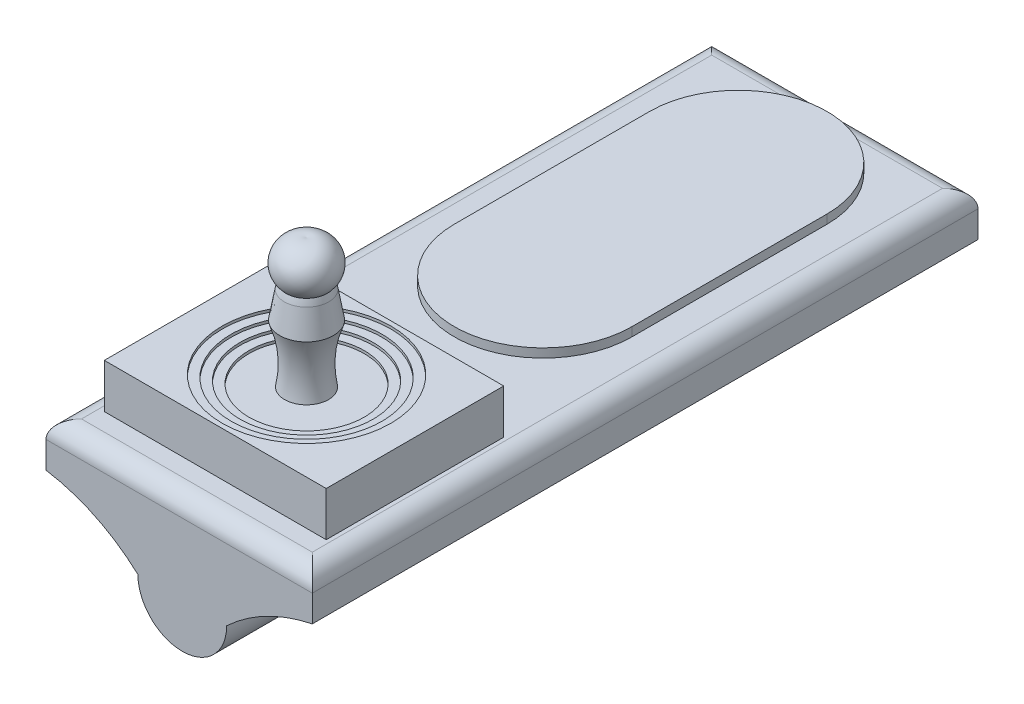
from build123d import *

# Parameters (mm, degrees)
BOSS_EXTRUDE2_DEPTH = 75
SKETCH2_R           = 4
CUT_EXTRUDE1_DEPTH  = 60
BOSS_EXTRUDE3_DEPTH = 1
SKETCH4_W           = 25
SKETCH4_H           = 20
BOSS_EXTRUDE4_DEPTH = 5
SKETCH5_R           = 9.5
CUT_EXTRUDE5_DEPTH  = 0.3
SKETCH9_R           = 8.5
CUT_EXTRUDE6_DEPTH  = 0.3
SKETCH10_R          = 7.5
CUT_EXTRUDE7_DEPTH  = 0.3
SKETCH11_R          = 6.5
CUT_EXTRUDE8_DEPTH  = 0.3
FILLET1_R           = 2


with BuildPart() as part:
    # Sketch1 → Boss-Extrude2 (new body)
    with BuildSketch(Plane.XY):
        with BuildLine():
            Line((-15.355814747, 10), (14.644185253, 10))
            Line((14.644185253, 10), (14.644185253, 5))
            ThreePointArc((14.644185253, 5), (9.476114191, 3.167336025), (5, 0))
            ThreePointArc((5, 0), (0, -5), (-5, 0))
            ThreePointArc((-5, 0), (-9.810792775, 3.260354155), (-15.355814747, 5))
            Line((-15.355814747, 5), (-15.355814747, 10))
        make_face()
    extrude(amount=-BOSS_EXTRUDE2_DEPTH)

    # Sketch2 → Cut-Extrude1 (cut)
    with BuildSketch(Plane(origin=(0, 0, -75), x_dir=(-1, 0, 0), z_dir=(0, 0, -1))):
        Circle(SKETCH2_R)
    extrude(amount=-CUT_EXTRUDE1_DEPTH, mode=Mode.SUBTRACT)

    # Sketch3 → Boss-Extrude3 (add)
    with BuildSketch(Plane(origin=(0, 10, 0), x_dir=(1, 0, 0), z_dir=(0, 1, 0))):
        with BuildLine():
            Line((-10.355814747, 41), (-10.355814747, 63))
            ThreePointArc((-10.355814747, 63), (-0.355814747, 73), (9.644185253, 63))
            Line((9.644185253, 63), (9.644185253, 41))
            ThreePointArc((9.644185253, 41), (-0.355814747, 31), (-10.355814747, 41))
        make_face()
    extrude(amount=BOSS_EXTRUDE3_DEPTH)

    # Sketch4 → Boss-Extrude4 (add)
    with BuildSketch(Plane(origin=(0, 10, 0), x_dir=(1, 0, 0), z_dir=(0, 1, 0))):
        with Locations((-0.28655183, 14)):
            Rectangle(SKETCH4_W, SKETCH4_H)
    extrude(amount=BOSS_EXTRUDE4_DEPTH)

    # Sketch5 → Cut-Extrude5 (cut)
    with BuildSketch(Plane(origin=(0, 15, 0), x_dir=(1, 0, 0), z_dir=(0, 1, 0))):
        with Locations(Location((0, 14, 0), (0, 0, 270))):
            Circle(SKETCH5_R)
    extrude(amount=-CUT_EXTRUDE5_DEPTH, mode=Mode.SUBTRACT)

    # Sketch9 → Cut-Extrude6 (cut)
    with BuildSketch(Plane(origin=(0, 14.7, 0), x_dir=(1, 0, 0), z_dir=(0, 1, 0))):
        with Locations(Location((0, 14, 0), (0, 0, 270))):
            Circle(SKETCH9_R)
    extrude(amount=-CUT_EXTRUDE6_DEPTH, mode=Mode.SUBTRACT)

    # Sketch10 → Cut-Extrude7 (cut)
    with BuildSketch(Plane(origin=(0, 14.4, 0), x_dir=(1, 0, 0), z_dir=(0, 1, 0))):
        with Locations(Location((0, 14, 0), (0, 0, 270))):
            Circle(SKETCH10_R)
    extrude(amount=-CUT_EXTRUDE7_DEPTH, mode=Mode.SUBTRACT)

    # Sketch11 → Cut-Extrude8 (cut)
    with BuildSketch(Plane(origin=(0, 14.1, 0), x_dir=(1, 0, 0), z_dir=(0, 1, 0))):
        with Locations(Location((0, 14, 0), (0, 0, 270))):
            Circle(SKETCH11_R)
    extrude(amount=-CUT_EXTRUDE8_DEPTH, mode=Mode.SUBTRACT)

    # Sketch12 → Revolve2 (revolve)
    with BuildSketch(Plane(origin=(0, 0, 0), x_dir=(0, 0, -1), z_dir=(1, 0, 0)), mode=Mode.PRIVATE) as revolve2_sk:
        with BuildLine():
            Line((14, 15), (14, 13.677907374))
            Line((14, 13.677907374), (11.5, 13.677907374))
            ThreePointArc((11.5, 13.677907374), (11.70459363, 17.043778802), (10.964658523, 20.333679266))
            Line((10.964658523, 20.333679266), (11.494340347, 23.356462384))
            ThreePointArc((11.494340347, 23.356462384), (12.09773994, 25.084923792), (13, 26.677907374))
            Line((13, 26.677907374), (14, 26.677907374))
            Line((14, 26.677907374), (14, 15))
        make_face()
    revolve(revolve2_sk.sketch.rotate(Axis((0, 13.677907374, -14), (0, 1, 0)), 180), axis=Axis((0, 13.677907374, -14), (0, 1, 0)))

    # Sketch13 → Revolve3 (revolve)
    with BuildSketch(Plane(origin=(0, 0, 0), x_dir=(0, 0, -1), z_dir=(1, 0, 0))):
        with BuildLine():
            Line((14, 23.403548627), (14, 28.403548627))
            ThreePointArc((14, 28.403548627), (17.081597334, 25.903548627), (14, 23.403548627))
        make_face()
    revolve(axis=Axis((0, 23.403548627, -14), (0, 1, 0)))

    # Fillet1
    fillet1_edges = [part.edges().sort_by_distance(p)[0] for p in [
        (-15.355814747, 10, -37.5),
        (14.644185253, 10, -37.5),
        (-0.355814747, 10, 0),
        (-0.355814747, 10, -75),
    ]]
    fillet(fillet1_edges, radius=FILLET1_R - 0.0001)  # a hair under: the kernel refuses the full size


solid = part.part
